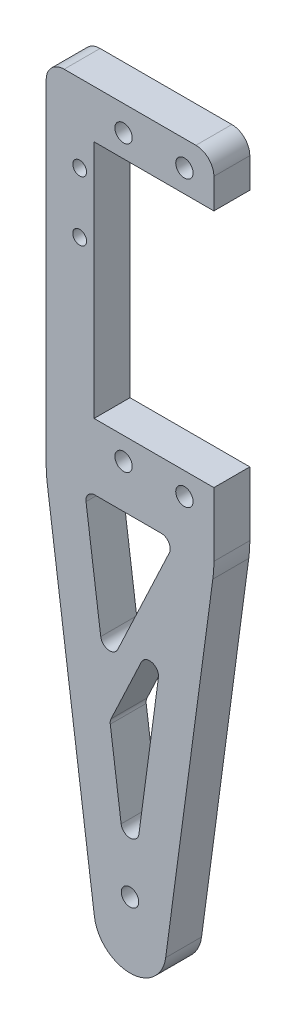
from build123d import *

# Parameters (mm, degrees)
BOSS_EXTRU_1_DEPTH      = 6
CONG_1_R                = 3
CONG_2_R                = 20
ENL_V_MAT_EXTRU_1_REACH = 98.413
ESQUISSE2_R             = 1.45
ENL_V_MAT_EXTRU_2_REACH = 98.413
CONG_3_R                = 1.5
ESQUISSE4_R             = 1.45
ENL_V_MAT_EXTRU_3_DEPTH = 6
ESQUISSE5_R             = 1.15
ENL_V_MAT_EXTRU_4_DEPTH = 6


with BuildPart() as part:
    # Esquisse1 → Boss.-Extru.1 (new body)
    with BuildSketch(Plane.XY):
        with BuildLine():
            Line((-14, -30), (-5.946672736, -90))
            ThreePointArc((-5.946672736, -90), (0, -95.201824972), (5.946672736, -90))
            Line((5.946672736, -90), (14, -30))
            Line((14, -30), (14, -18))
            Line((14, -18), (-6, -18))
            Line((-6, -18), (-6, 22))
            Line((-6, 22), (14, 22))
            Line((14, 22), (14, 30))
            Line((14, 30), (-14, 30))
            Line((-14, 30), (-14, -30))
        make_face()
    extrude(amount=BOSS_EXTRU_1_DEPTH)

    # Congé1
    cong_1_edges = [part.edges().sort_by_distance(p)[0] for p in [
        (-14, 30, 3),
        (14, 30, 3),
    ]]
    fillet(cong_1_edges, radius=CONG_1_R)

    # Congé2
    cong_2_edges = [part.edges().sort_by_distance(p)[0] for p in [
        (14, -30, 3),
        (-14, -30, 3),
    ]]
    fillet(cong_2_edges, radius=CONG_2_R)

    # Esquisse2 → Enlèv. mat.-Extru.1 (cut, up to next)
    with BuildSketch(Plane.XY.offset(6), mode=Mode.PRIVATE) as enl_v_mat_extru_1_sk1:
        with Locations((9.08, -21.75)):
            Circle(ESQUISSE2_R)
    enl_v_mat_extru_1_tool1 = extrude(enl_v_mat_extru_1_sk1.sketch, amount=-ENL_V_MAT_EXTRU_1_REACH, mode=Mode.PRIVATE) & part.part
    # Esquisse2 → Enlèv. mat.-Extru.1 (cut, up to next)
    with BuildSketch(Plane.XY.offset(6), mode=Mode.PRIVATE) as enl_v_mat_extru_1_sk2:
        with Locations((-1.08, -21.75)):
            Circle(ESQUISSE2_R)
    enl_v_mat_extru_1_tool2 = extrude(enl_v_mat_extru_1_sk2.sketch, amount=-ENL_V_MAT_EXTRU_1_REACH, mode=Mode.PRIVATE) & part.part
    # Esquisse2 → Enlèv. mat.-Extru.1 (cut, up to next)
    with BuildSketch(Plane.XY.offset(6), mode=Mode.PRIVATE) as enl_v_mat_extru_1_sk3:
        with Locations((-1.08, 25.75)):
            Circle(ESQUISSE2_R)
    enl_v_mat_extru_1_tool3 = extrude(enl_v_mat_extru_1_sk3.sketch, amount=-ENL_V_MAT_EXTRU_1_REACH, mode=Mode.PRIVATE) & part.part
    # Esquisse2 → Enlèv. mat.-Extru.1 (cut, up to next)
    with BuildSketch(Plane.XY.offset(6), mode=Mode.PRIVATE) as enl_v_mat_extru_1_sk4:
        with Locations((9.08, 25.75)):
            Circle(ESQUISSE2_R)
    enl_v_mat_extru_1_tool4 = extrude(enl_v_mat_extru_1_sk4.sketch, amount=-ENL_V_MAT_EXTRU_1_REACH, mode=Mode.PRIVATE) & part.part
    add(enl_v_mat_extru_1_tool1.solids().sort_by_distance((9.08, -21.75, 6))[0], mode=Mode.SUBTRACT)
    add(enl_v_mat_extru_1_tool2.solids().sort_by_distance((-1.08, -21.75, 6))[0], mode=Mode.SUBTRACT)
    add(enl_v_mat_extru_1_tool3.solids().sort_by_distance((-1.08, 25.75, 6))[0], mode=Mode.SUBTRACT)
    add(enl_v_mat_extru_1_tool4.solids().sort_by_distance((9.08, 25.75, 6))[0], mode=Mode.SUBTRACT)

    # Esquisse3 → Enlèv. mat.-Extru.2 (cut, up to next)
    with BuildSketch(Plane.XY.offset(6), mode=Mode.PRIVATE) as enl_v_mat_extru_2_sk1:
        Polygon((-7.57593285, -29), (-4.216847022, -54.026320563), (7.57593285, -29), align=None)
    enl_v_mat_extru_2_tool1 = extrude(enl_v_mat_extru_2_sk1.sketch, amount=-ENL_V_MAT_EXTRU_2_REACH, mode=Mode.PRIVATE) & part.part
    # Esquisse3 → Enlèv. mat.-Extru.2 (cut, up to next)
    with BuildSketch(Plane.XY.offset(6), mode=Mode.PRIVATE) as enl_v_mat_extru_2_sk2:
        Polygon((6.034890179, -40.481286835), (-3.359085829, -60.416930293), (0, -85.443250856), align=None)
    enl_v_mat_extru_2_tool2 = extrude(enl_v_mat_extru_2_sk2.sketch, amount=-ENL_V_MAT_EXTRU_2_REACH, mode=Mode.PRIVATE) & part.part
    add(enl_v_mat_extru_2_tool1.solids().sort_by_distance((-1.405616, -37.342107, 6))[0], mode=Mode.SUBTRACT)
    add(enl_v_mat_extru_2_tool2.solids().sort_by_distance((0.891935, -62.113823, 6))[0], mode=Mode.SUBTRACT)

    # Congé3
    cong_3_edges = [part.edges().sort_by_distance(p)[0] for p in [
        (7.57593285, -29, 3),
        (-4.216847022, -54.026320563, 3),
        (-7.57593285, -29, 3),
        (0, -85.443250856, 3),
        (-3.359085829, -60.416930293, 3),
        (6.034890179, -40.481286835, 3),
    ]]
    fillet(cong_3_edges, radius=CONG_3_R)

    # Esquisse4 → Enlèv. mat.-Extru.3 (cut)
    with BuildSketch(Plane.XY.offset(6)):
        with Locations((0, -84.201824972)):
            Circle(ESQUISSE4_R)
    extrude(amount=-ENL_V_MAT_EXTRU_3_DEPTH, mode=Mode.SUBTRACT)

    # Esquisse5 → Enlèv. mat.-Extru.4 (cut)
    with BuildSketch(Plane.XY.offset(6)):
        with Locations((-8.41, 17)):
            Circle(ESQUISSE5_R)
        with Locations((-8.41, 7)):
            Circle(ESQUISSE5_R)
    extrude(amount=-ENL_V_MAT_EXTRU_4_DEPTH, mode=Mode.SUBTRACT)


solid = part.part
